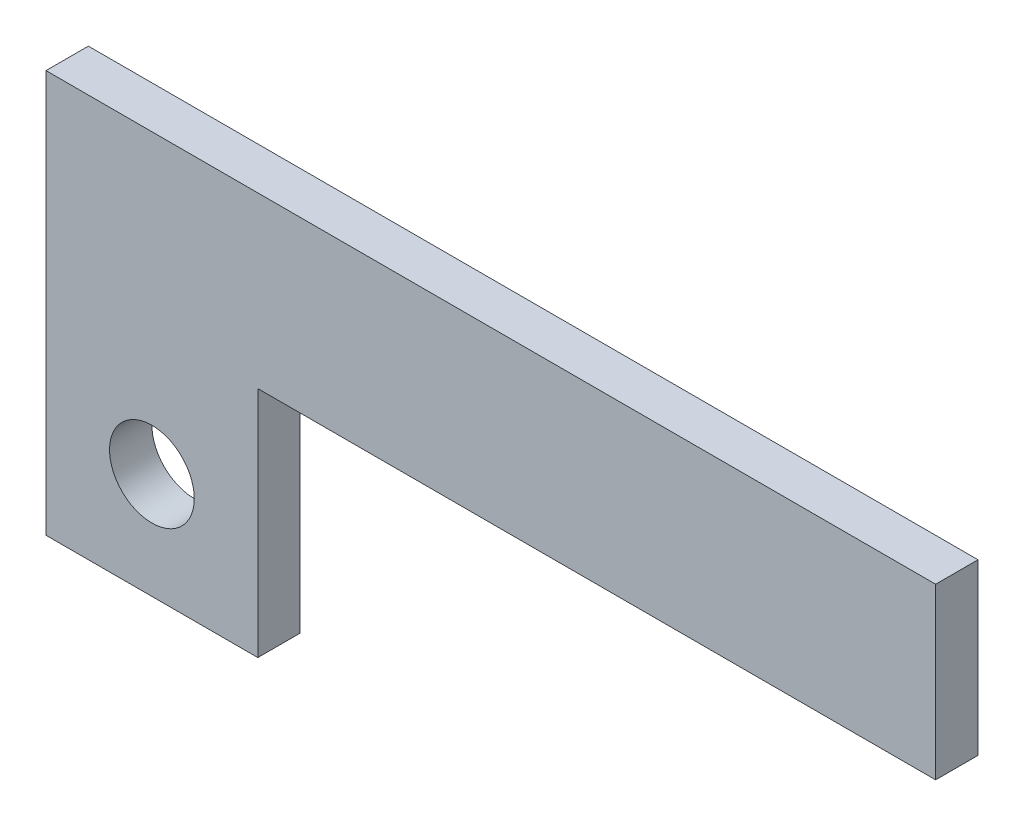
from build123d import *

# Parameters (mm, degrees)
BASE_FLANGE1_DEPTH      = 19
CUT_EXTRUDE1_DEPTH      = 47.270941205
CUT_EXTRUDE1_DEPTH_BACK = 47.270941205
SKETCH5_W               = 32
SKETCH5_H               = 11
SKETCH6_R               = 2
CUT_EXTRUDE2_DEPTH      = 47.270941205
CUT_EXTRUDE4_DEPTH      = 47.270941205
CUT_EXTRUDE4_DEPTH_BACK = 47.270941205
SKETCH7_W               = 30.575
SKETCH7_H               = 8
SKETCH8_W               = 30.575
SKETCH8_H               = 8
TAB1_DEPTH              = 2


# Sheet-metal steps are written as plain solids
with BuildPart() as part:
    # Sketch2 → Base-Flange1 (new body)
    with BuildSketch(Plane(origin=(0, 0, 0), x_dir=(1, 0, 0), z_dir=(0, 1, 0))):
        with BuildLine():
            Line((0, 0), (12.85, 0))
            ThreePointArc((12.85, 0), (14.37027958, -0.62972042), (15, -2.15))
            Line((15, -2.15), (15, -3.85))
            ThreePointArc((15, -3.85), (15.043933983, -3.956066017), (15.15, -4))
            Line((15.15, -4), (42, -4))
            Line((42, -4), (42, -6))
            Line((42, -6), (15.15, -6))
            ThreePointArc((15.15, -6), (13.62972042, -5.37027958), (13, -3.85))
            Line((13, -3.85), (13, -2.15))
            ThreePointArc((13, -2.15), (12.956066017, -2.043933983), (12.85, -2))
            Line((12.85, -2), (0, -2))
            Line((0, -2), (0, 0))
        make_face()
    extrude(amount=BASE_FLANGE1_DEPTH)

    # Sketch5 → Cut-Extrude1 (cut, two sides: drawn at the far end of the back side and taken through both)
    with BuildSketch(Plane.XY.offset(2).offset(-CUT_EXTRUDE1_DEPTH_BACK)):
        with Locations((26, 5.5)):
            Rectangle(SKETCH5_W, SKETCH5_H)
    extrude(amount=CUT_EXTRUDE1_DEPTH + CUT_EXTRUDE1_DEPTH_BACK, mode=Mode.SUBTRACT)

    # Sketch6 → Cut-Extrude2 (cut, through all)
    with BuildSketch(Plane.XY.offset(2)):
        with Locations((5, 5)):
            Circle(SKETCH6_R)
    extrude(amount=-CUT_EXTRUDE2_DEPTH, mode=Mode.SUBTRACT)

    # Sketch7 → Cut-Extrude4 (cut, two sides: drawn at the far end of the back side and taken through both)
    with BuildSketch(Plane.XY.offset(2).offset(-CUT_EXTRUDE4_DEPTH_BACK)):
        with Locations((26.7125, 15)):
            Rectangle(SKETCH7_W, SKETCH7_H)
    extrude(amount=CUT_EXTRUDE4_DEPTH + CUT_EXTRUDE4_DEPTH_BACK, mode=Mode.SUBTRACT)

    # Sketch8 → Tab1 (add)
    with BuildSketch(Plane.XY.offset(2)):
        with Locations((26.7125, 15)):
            Rectangle(SKETCH8_W, SKETCH8_H)
    extrude(amount=-TAB1_DEPTH)


solid = part.part
